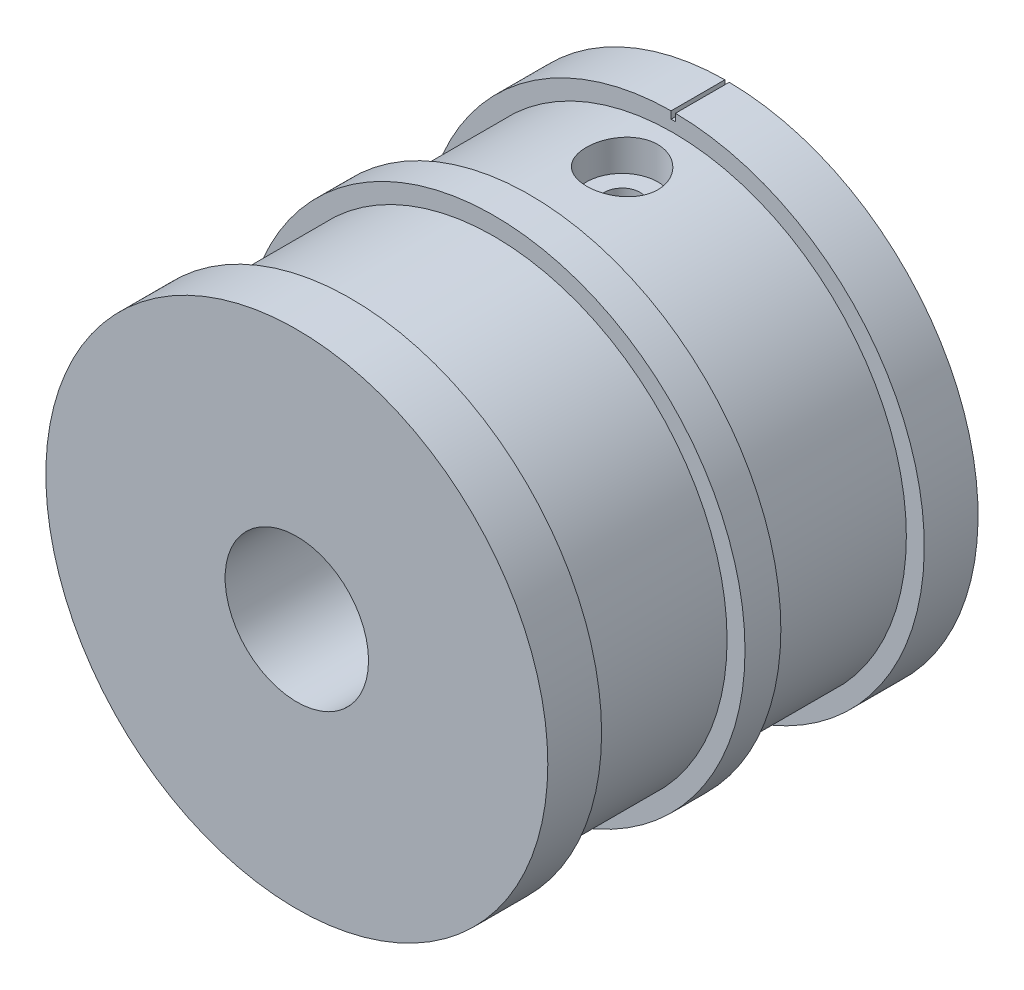
from build123d import *

# Parameters (mm, degrees)
ESQUISSE1_R                 = 35
ESQUISSE1_R_2               = 10
BOSS_EXTRU_1_DEPTH          = 7.5
ESQUISSE2_R                 = 32.5
ESQUISSE2_R_2               = 10
BOSS_EXTRU_2_DEPTH          = 20
ESQUISSE3_R                 = 35
ESQUISSE3_R_2               = 10
BOSS_EXTRU_3_DEPTH          = 5
ESQUISSE4_R                 = 32.5
ESQUISSE4_R_2               = 10
BOSS_EXTRU_4_DEPTH          = 20
ESQUISSE5_R                 = 35
ESQUISSE5_R_2               = 10
BOSS_EXTRU_5_DEPTH          = 7.5
ESQUISSE7_W                 = 0.6
ESQUISSE7_H                 = 2.216048933
ENL_V_MAT_EXTRU_3_DEPTH     = 7.5
ENL_V_MAT_EXTRU_6_OUTLINE_W = 5
ENL_V_MAT_EXTRU_6_OUTLINE_H = 4.514677359
ENL_V_START                 = 9.580417676
ENL_V_MAT_EXTRU_7_OUTLINE_R = 2.5
ENL_V_MAT_EXTRU_7_DEPTH     = 18.40495848


# Read off the part's stored shape, not the designer's step: Enlèv. mat.-Extru.6, Enlèv. mat.-Extru.7
with BuildPart() as part:
    # Esquisse1 → Boss.-Extru.1 (new body)
    with BuildSketch(Plane.XY):
        Circle(ESQUISSE1_R)
        Circle(ESQUISSE1_R_2, mode=Mode.SUBTRACT)
    extrude(amount=BOSS_EXTRU_1_DEPTH)

    # Esquisse2 → Boss.-Extru.2 (add)
    with BuildSketch(Plane.XY.offset(7.5)):
        Circle(ESQUISSE2_R)
        Circle(ESQUISSE2_R_2, mode=Mode.SUBTRACT)
    extrude(amount=BOSS_EXTRU_2_DEPTH)

    # Esquisse3 → Boss.-Extru.3 (add)
    with BuildSketch(Plane.XY.offset(27.5)):
        Circle(ESQUISSE3_R)
        Circle(ESQUISSE3_R_2, mode=Mode.SUBTRACT)
    extrude(amount=BOSS_EXTRU_3_DEPTH)

    # Esquisse4 → Boss.-Extru.4 (add)
    with BuildSketch(Plane.XY.offset(32.5)):
        Circle(ESQUISSE4_R)
        Circle(ESQUISSE4_R_2, mode=Mode.SUBTRACT)
    extrude(amount=BOSS_EXTRU_4_DEPTH)

    # Esquisse5 → Boss.-Extru.5 (add)
    with BuildSketch(Plane.XY.offset(52.5)):
        Circle(ESQUISSE5_R)
        Circle(ESQUISSE5_R_2, mode=Mode.SUBTRACT)
    extrude(amount=BOSS_EXTRU_5_DEPTH)

    # Esquisse7 → Enlèv. mat.-Extru.3 (cut)
    with BuildSketch(Plane(origin=(0, 0, 0), x_dir=(-1, 0, 0), z_dir=(0, 0, -1))):
        with Locations((0, 35.093400622)):
            Rectangle(ESQUISSE7_W, ESQUISSE7_H)
    extrude(amount=-ENL_V_MAT_EXTRU_3_DEPTH, mode=Mode.SUBTRACT)

    # Enlèv. mat.-Extru.6 outline → Enlèv. mat.-Extru.6 (revolve, cut)
    with BuildSketch(Plane(origin=(0.366285961, 0, 15), x_dir=(1, 0, 0), z_dir=(0, 0, 1))):
        with Locations((2.5, 30.242714836)):
            Rectangle(ENL_V_MAT_EXTRU_6_OUTLINE_W, ENL_V_MAT_EXTRU_6_OUTLINE_H)
    revolve(axis=Axis((0.366285961, 0, 15), (0, 1, 0)), mode=Mode.SUBTRACT)

    # Enlèv. mat.-Extru.7 outline → Enlèv. mat.-Extru.7 (cut)
    with BuildSketch(Plane(origin=(0, 0, 0), x_dir=(1, 0, 0), z_dir=(0, 1, 0)).offset(ENL_V_START)):
        with Locations((0.366285961, -15)):
            Circle(ENL_V_MAT_EXTRU_7_OUTLINE_R)
    extrude(amount=ENL_V_MAT_EXTRU_7_DEPTH, mode=Mode.SUBTRACT)


solid = part.part
